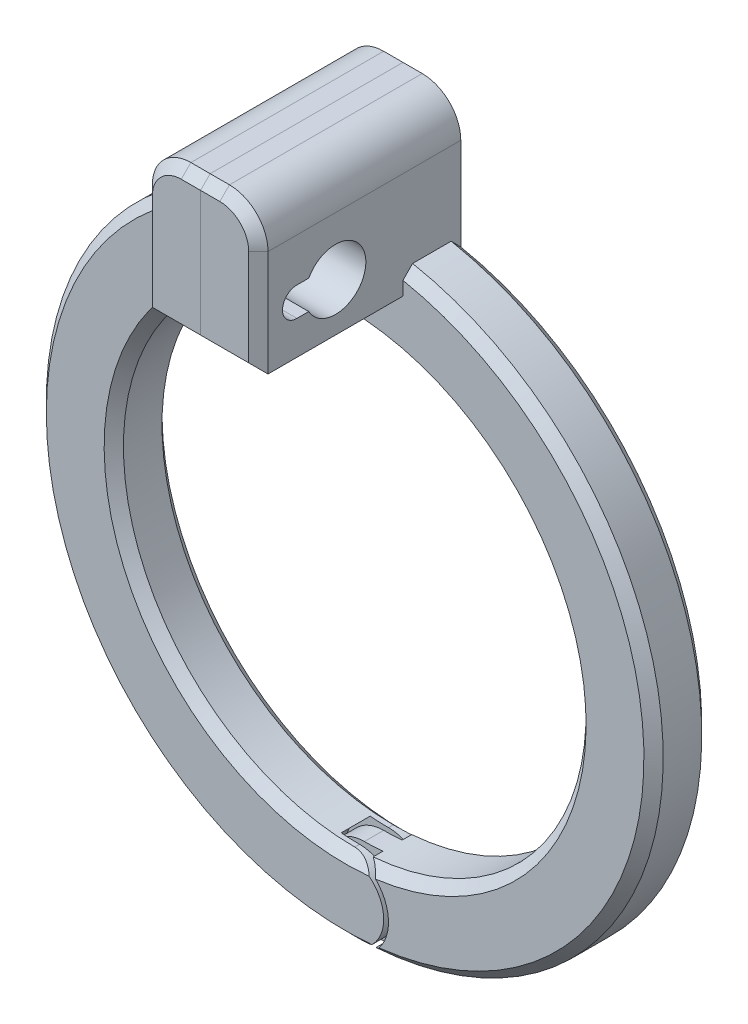
from build123d import *

# Parameters (mm, degrees)
AUFSATZ_LINEAR_AUSTRAGEN1_DEPTH             = 3
SKIZZE2_R                                   = 4.5
SCHNITT_LINEAR_AUSTRAGEN1_DEPTH             = 1.5
AUFSATZ_LINEAR_AUSTRAGEN2_REACH             = 73.617
SKIZZE3_R                                   = 2
AUFSATZ_LINEAR_AUSTRAGEN2_DIRECTION_2_REACH = 73.617
SKIZZE4_R                                   = 2.5
AUFSATZ_LINEAR_AUSTRAGEN4_DEPTH             = 3
SKIZZE5_R                                   = 4.5
SCHNITT_LINEAR_AUSTRAGEN2_DEPTH             = 2
AUFSATZ_LINEAR_START                        = -6
AUFSATZ_LINEAR_AUSTRAGEN5_DEPTH             = 6
AUFSATZ_LINEAR_AUSTRAGEN6_DEPTH             = 6
AUFSATZ_LINEAR_AUSTRAGEN7_DEPTH             = 15
AUFSATZ_LINEAR_START_2                      = 15
AUFSATZ_LINEAR_AUSTRAGEN9_DEPTH             = 15
SCHNITT_LINEAR_AUSTRAGEN3_DEPTH             = 6.5
FASE1_SIZE                                  = 1
FASE2_SIZE                                  = 1
FASE3_SIZE                                  = 1
FASE4_START                                 = -3
FASE4_2_DEPTH                               = 6
FASE5_SIZE                                  = 1
FASE6_SIZE                                  = 1


with BuildPart() as part:
    # Skizze1 → Aufsatz-Linear austragen1 (new, symmetric)
    with BuildSketch(Plane.XY):
        with BuildLine():
            Line((0, -8), (0, 0))
            ThreePointArc((0, 0), (-32, -32), (0, -64))
            ThreePointArc((0, -64), (4, -60), (0, -56))
            ThreePointArc((0, -56), (-24, -32), (0, -8))
        make_face()
    extrude(amount=AUFSATZ_LINEAR_AUSTRAGEN1_DEPTH, both=True)

    # Skizze2 → Schnitt-Linear austragen1 (cut, symmetric)
    with BuildSketch(Plane.XY):
        with Locations((0, -60)):
            Circle(SKIZZE2_R)
    extrude(amount=SCHNITT_LINEAR_AUSTRAGEN1_DEPTH, both=True, mode=Mode.SUBTRACT)

    # Aufsatz-Linear austragen2: up to this face of the body (flat: up to its plane)
    aufsatz_linear_austragen2_end = Plane(part.part.faces().sort_by_distance((-0.306004635, -59.992467517, 1.5))[0])
    # Skizze3 → Aufsatz-Linear austragen2 (add, up to the picked face)
    with BuildSketch(Plane.XY, mode=Mode.PRIVATE) as aufsatz_linear_austragen2_sk1:
        with Locations((0, -60)):
            Circle(SKIZZE3_R)
    aufsatz_linear_austragen2_tool1 = split(extrude(aufsatz_linear_austragen2_sk1.sketch, amount=AUFSATZ_LINEAR_AUSTRAGEN2_REACH, mode=Mode.PRIVATE), bisect_by=aufsatz_linear_austragen2_end, keep=Keep.BOTH, mode=Mode.PRIVATE)
    add(aufsatz_linear_austragen2_tool1.solids().sort_by(Axis((0, -60, 0), (0, 0, 1)))[0])

    # Aufsatz-Linear austragen2 direction 2: up to this face of the body (flat: up to its plane)
    aufsatz_linear_austragen2_direction_2_end = Plane(part.part.faces().sort_by_distance((-0.306004635, -59.992467517, -1.5))[0])
    # Skizze3 → Aufsatz-Linear austragen2 direction 2 (add, up to the picked face)
    with BuildSketch(Plane.XY, mode=Mode.PRIVATE) as aufsatz_linear_austragen2_direction_2_sk1:
        with Locations((0, -60)):
            Circle(SKIZZE3_R)
    aufsatz_linear_austragen2_direction_2_tool1 = split(extrude(aufsatz_linear_austragen2_direction_2_sk1.sketch, amount=-AUFSATZ_LINEAR_AUSTRAGEN2_DIRECTION_2_REACH, mode=Mode.PRIVATE), bisect_by=aufsatz_linear_austragen2_direction_2_end, keep=Keep.BOTH, mode=Mode.PRIVATE)
    add(aufsatz_linear_austragen2_direction_2_tool1.solids().sort_by(Axis((0, -60, 0), (0, 0, -1)))[0])

    # Skizze7 → Aufsatz-Linear austragen6 (add)
    with BuildSketch(Plane(origin=(0, 0, -3), x_dir=(-1, 0, 0), z_dir=(0, 0, -1)).offset(AUFSATZ_LINEAR_START)):
        with BuildLine():
            Line((0, 0), (0, 12))
            Line((0, 12), (2, 12))
            ThreePointArc((2, 12), (4.828427125, 10.828427125), (6, 8))
            Line((6, 8), (6, -0.567532709))
            ThreePointArc((6, -0.567532709), (3.013390672, -0.142199124), (0, 0))
        make_face()
    extrude(amount=AUFSATZ_LINEAR_AUSTRAGEN6_DEPTH)

    # Skizze9 → Aufsatz-Linear austragen9 (add)
    with BuildSketch(Plane.XY.offset(3).offset(AUFSATZ_LINEAR_START_2)):
        with BuildLine():
            Line((-6, -3), (0, -3))
            Line((0, -3), (0, 12))
            Line((0, 12), (-2, 12))
            ThreePointArc((-2, 12), (-4.828427125, 10.828427125), (-6, 8))
            Line((-6, 8), (-6, -0.567532709))
            Line((-6, -0.567532709), (-6, -3))
        make_face()
    extrude(amount=-AUFSATZ_LINEAR_AUSTRAGEN9_DEPTH)


with BuildPart() as body_2:
    # Skizze4 → Aufsatz-Linear austragen4 (new, symmetric)
    with BuildSketch(Plane.XY):
        with BuildLine():
            Line((0, -8), (0, 0))
            ThreePointArc((0, 0), (32, -32), (0, -64))
            ThreePointArc((0, -64), (-4, -60), (0, -56))
            ThreePointArc((0, -56), (24, -32), (0, -8))
        make_face()
        with Locations((0, -60)):
            Circle(SKIZZE4_R, mode=Mode.SUBTRACT)
    extrude(amount=AUFSATZ_LINEAR_AUSTRAGEN4_DEPTH, both=True)

    # Skizze5 → Schnitt-Linear austragen2 (cut)
    with BuildSketch(Plane.XY.offset(3)):
        with Locations((0, -60)):
            Circle(SKIZZE5_R)
    schnitt_linear_austragen2 = extrude(amount=-SCHNITT_LINEAR_AUSTRAGEN2_DEPTH, mode=Mode.SUBTRACT)

    # Spiegeln1: Schnitt-Linear austragen2 across plane
    add(schnitt_linear_austragen2.mirror(Plane.XY), mode=Mode.SUBTRACT)

    # Skizze6 → Aufsatz-Linear austragen5 (add)
    with BuildSketch(Plane(origin=(0, 0, -3), x_dir=(-1, 0, 0), z_dir=(0, 0, -1)).offset(AUFSATZ_LINEAR_START)):
        with BuildLine():
            Line((0, 0), (0, 12))
            Line((0, 12), (-2, 12))
            ThreePointArc((-2, 12), (-4.828427125, 10.828427125), (-6, 8))
            Line((-6, 8), (-6, -0.567532709))
            ThreePointArc((-6, -0.567532709), (-3.013390672, -0.142199124), (0, 0))
        make_face()
    extrude(amount=AUFSATZ_LINEAR_AUSTRAGEN5_DEPTH)

    # Skizze8 → Aufsatz-Linear austragen7 (add)
    with BuildSketch(Plane.XY.offset(3)):
        with BuildLine():
            Line((0, -3), (6, -3))
            Line((6, -3), (6, 8))
            ThreePointArc((6, 8), (4.828427125, 10.828427125), (2, 12))
            Line((2, 12), (0, 12))
            Line((0, 12), (0, -3))
        make_face()
    extrude(amount=AUFSATZ_LINEAR_AUSTRAGEN7_DEPTH)


with BuildPart() as schnitt_linear_austragen3_tool:
    # Skizze10 → Schnitt-Linear austragen3 (new, symmetric)
    with BuildSketch(Plane(origin=(0, 0, 0), x_dir=(0, 0, -1), z_dir=(1, 0, 0))):
        with BuildLine():
            Line((-14, 0.5), (-12.769927797, 0.5))
            ThreePointArc((-12.769927797, 0.5), (-6.85, 2), (-12.769927797, 3.5))
            Line((-12.769927797, 3.5), (-14, 3.5))
            ThreePointArc((-14, 3.5), (-15.5, 2), (-14, 0.5))
        make_face()
    extrude(amount=SCHNITT_LINEAR_AUSTRAGEN3_DEPTH, both=True)


with BuildPart() as part_1:
    add(part.part)

    # Schnitt-Linear austragen3: cut by schnitt_linear_austragen3_tool
    add(schnitt_linear_austragen3_tool.part, mode=Mode.SUBTRACT)

    # Fase2
    # the kernel refuses this chamfer: 1 mm, written as the material it takes off along each edge
    with BuildSketch(Plane(origin=(0, -32, 3), x_dir=(0.10711985504033346, -0.9942461147302201, 0), z_dir=(0.9942461147302201, 0.10711985504033346, 0))) as fase2_piece_1:
        Polygon((24, FASE2_SIZE), (24 + FASE2_SIZE, 0), (24, 0), align=None)
    revolve(axis=Axis((0, -32, 3), (0, 0, -1)), revolution_arc=192.298628552, mode=Mode.SUBTRACT)
    with BuildSketch(Plane(origin=(0, -32, -3), x_dir=(0.10711985504033346, -0.9942461147302201, 0), z_dir=(0.9942461147302201, 0.10711985504033346, 0))) as fase2_piece_2:
        Polygon((24, -FASE2_SIZE), (24 + FASE2_SIZE, 0), (24, 0), align=None)
    revolve(axis=Axis((0, -32, -3), (0, 0, -1)), revolution_arc=192.298628552, mode=Mode.SUBTRACT)

    # Fase4: read off the stored shape, not the designer's step
    # Fase4 outline → Fase4 (revolve, cut)
    with BuildSketch(Plane.XZ.offset(32)):
        Polygon((32.000006898, 3), (31, 3), (32.000006898, 1.999993102), align=None)
        Polygon((32.000006898, -3), (32.000006898, -1.999994955), (31, -3), align=None)
    revolve(axis=Axis((0, -32, 0), (0, 0, 1)), mode=Mode.SUBTRACT)

    # Fase4 2 outline → Fase4 2 (add)
    with BuildSketch(Plane.XY.offset(FASE4_START)):
        with BuildLine():
            Line((0, -1), (0, 6.898e-06))
            ThreePointArc((0, 6.898e-06), (-3.013390666, -0.142192195), (-6, -0.567525686))
            Line((-6, -0.567525686), (-6, -1.586187349))
            ThreePointArc((-6, -1.586187349), (-3.014283315, -1.146894871), (0, -1))
        make_face()
    extrude(amount=FASE4_2_DEPTH)

    # Fase6
    fase6_edges = [part_1.edges().sort_by_distance(p)[0] for p in [
        (-3, -3, 18),
        (-4.828427125, 10.828427125, 18),
        (-6, 2.5, 18),
        (-1, 12, 18),
    ]]
    chamfer(fase6_edges, length=FASE6_SIZE)


with BuildPart() as body_2_1:
    add(body_2.part)

    # Schnitt-Linear austragen3: cut by schnitt_linear_austragen3_tool
    add(schnitt_linear_austragen3_tool.part, mode=Mode.SUBTRACT)

    # Fase1
    fase1_edges = [body_2_1.edges().sort_by_distance(p)[0] for p in [
        (23.98101928, -31.045686485, 3),
        (23.98101928, -31.045686485, -3),
    ]]
    chamfer(fase1_edges, length=FASE1_SIZE)

    # Fase3
    fase3_edges = [body_2_1.edges().sort_by_distance(p)[0] for p in [
        (31.942674958, -33.914553878, 3),
        (31.942674958, -33.914553878, -3),
    ]]
    chamfer(fase3_edges, length=FASE3_SIZE)

    # Fase5
    fase5_edges = [body_2_1.edges().sort_by_distance(p)[0] for p in [
        (3, -3, 18),
        (6, 2.5, 18),
        (4.828427125, 10.828427125, 18),
        (1, 12, 18),
    ]]
    chamfer(fase5_edges, length=FASE5_SIZE)


solid = Compound([part_1.part, body_2_1.part])
